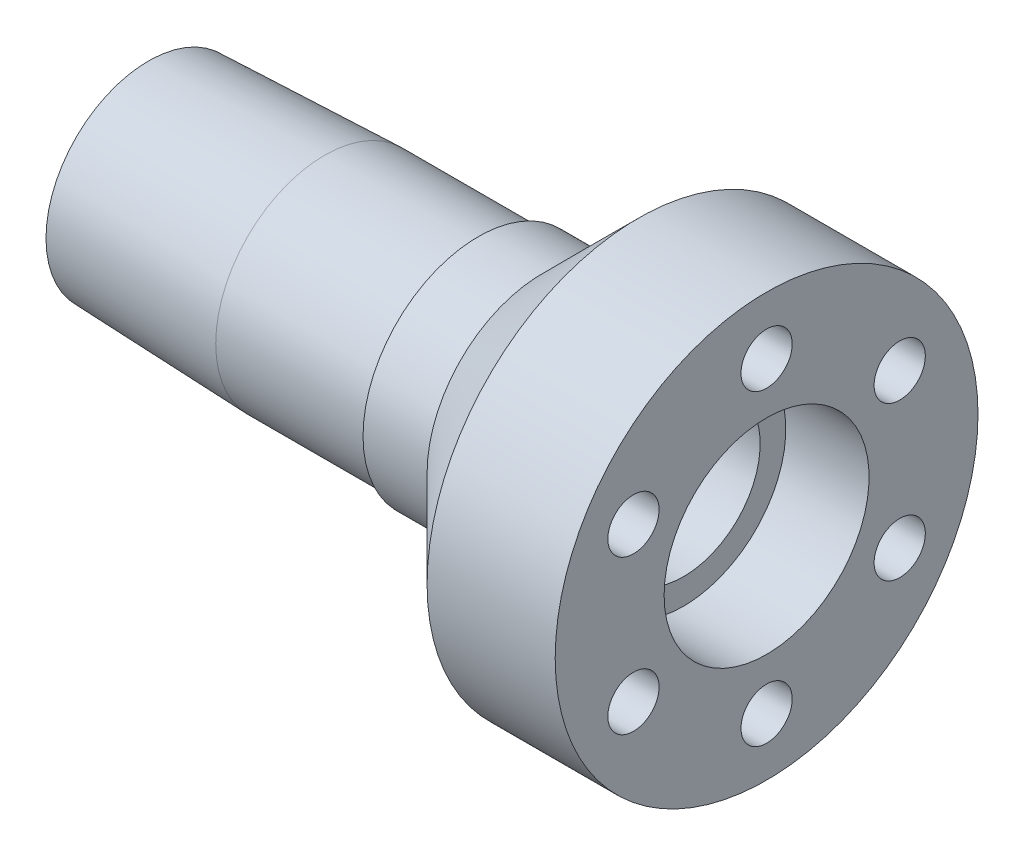
from build123d import *

# Parameters (mm, degrees)
SKETCH7_R          = 2
CUT_EXTRUDE2_DEPTH = 8


with BuildPart() as part:
    # Sketch2 → Revolve1 (revolve)
    with BuildSketch(Plane.XY):
        Polygon((0, 8), (0, 6), (41.75, 6), (41.75, 8), (48.25, 8), (48.25, 16.502402586), (38.25, 16.502402586), (30.747597414, 9), (25.747597414, 9), (25.747597414, 8.5), (13.747597414, 8.5), align=None)
    revolve(axis=Axis((0, 0, 0), (1, 0, 0)))

    # Sketch7 → Cut-Extrude2 (cut)
    with BuildSketch(Plane(origin=(48.25, 0, 0), x_dir=(0, 0, -1), z_dir=(1, 0, 0))):
        with Locations((0, 12)):
            Circle(SKETCH7_R)
        with Locations((10.392304845, 6)):
            Circle(SKETCH7_R)
        with Locations((10.392304845, -6)):
            Circle(SKETCH7_R)
        with Locations((0, -12)):
            Circle(SKETCH7_R)
        with Locations((-10.392304845, -6)):
            Circle(SKETCH7_R)
        with Locations((-10.392304845, 6)):
            Circle(SKETCH7_R)
    extrude(amount=-CUT_EXTRUDE2_DEPTH, mode=Mode.SUBTRACT)


solid = part.part
